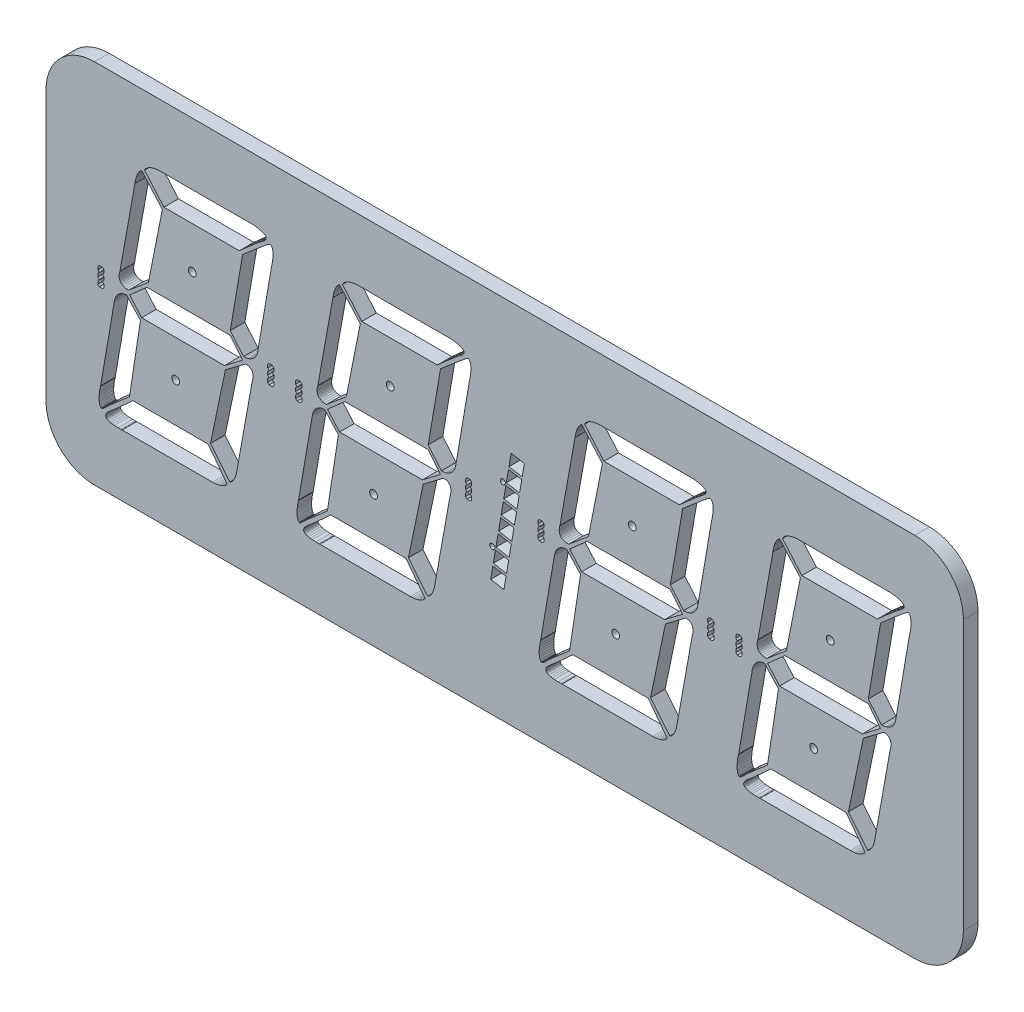
from build123d import *

# Parameters (mm, degrees)
CROQUIS1_R              = 1.6
CROQUIS1_R_2            = 1.054294776
SALIENTE_EXTRUIR1_DEPTH = 6


with BuildPart() as part:
    # Croquis1 → Saliente-Extruir1 (new body)
    with BuildSketch(Plane.XY):
        with BuildLine():
            Line((94.93, 110.871), (94.93, 0))
            ThreePointArc((94.93, 0), (89.072135624, -14.142135624), (74.93, -20))
            Line((74.93, -20), (-262.531032337, -20))
            ThreePointArc((-262.531032337, -20), (-276.673167961, -14.142135624), (-282.531032337, 0))
            Line((-282.531032337, 0), (-282.531032337, 110.871))
            ThreePointArc((-282.531032337, 110.871), (-276.673167961, 125.013135624), (-262.531032337, 130.871))
            Line((-262.531032337, 130.871), (74.93, 130.871))
            ThreePointArc((74.93, 130.871), (89.072135624, 125.013135624), (94.93, 110.871))
        make_face()
        with Locations((-48.1255, 34.1427)):
            Circle(CROQUIS1_R, mode=Mode.SUBTRACT)
        with Locations((33.3045, 34.1427)):
            Circle(CROQUIS1_R, mode=Mode.SUBTRACT)
        with Locations((40.1269, 76.0705)):
            Circle(CROQUIS1_R, mode=Mode.SUBTRACT)
        with Locations((-41.3031, 76.0705)):
            Circle(CROQUIS1_R, mode=Mode.SUBTRACT)
        with Locations((-98.91149665, 39.952671307)):
            Circle(CROQUIS1_R_2, mode=Mode.SUBTRACT)
        with Locations((-94.590589685, 65.177763821)):
            Circle(CROQUIS1_R_2, mode=Mode.SUBTRACT)
        with Locations((-140.933851545, 76.0705)):
            Circle(CROQUIS1_R, mode=Mode.SUBTRACT)
        with Locations((-147.756251545, 34.1427)):
            Circle(CROQUIS1_R, mode=Mode.SUBTRACT)
        with Locations((-222.363851545, 76.0705)):
            Circle(CROQUIS1_R, mode=Mode.SUBTRACT)
        with Locations((-229.186251545, 34.1427)):
            Circle(CROQUIS1_R, mode=Mode.SUBTRACT)
        with BuildLine():
            Line((67.9113425, 100.564559567), (69.4411, 101.7626))
            Line((69.4411, 101.7626), (70.0481, 102.301))
            Line((70.0481, 102.301), (70.2539, 102.55))
            Line((70.2539, 102.55), (70.3986, 102.7862))
            Line((70.3986, 102.7862), (70.485, 103.0097))
            Line((70.485, 103.0097), (70.5206, 103.2205))
            Line((70.5206, 103.2205), (70.5053, 103.4212))
            Line((70.5053, 103.4212), (70.4444, 103.6091))
            Line((70.4444, 103.6091), (70.3428, 103.7844))
            Line((70.3428, 103.7844), (70.2031, 103.9495))
            Line((70.2031, 103.9495), (69.8246, 104.2492))
            Line((69.8246, 104.2492), (69.3395, 104.5083))
            Line((69.3395, 104.5083), (68.7781, 104.7293))
            Line((68.7781, 104.7293), (68.1685, 104.9147))
            Line((68.1685, 104.9147), (67.5437, 105.0671))
            Line((67.5437, 105.0671), (66.3626, 105.2855))
            Line((66.3626, 105.2855), (65.1307, 105.4329))
            Line((65.1307, 105.4329), (49.15669989, 105.387245475))
            ThreePointArc((49.15669989, 105.387245475), (49.105988252, 105.336299978), (49.055099911, 105.387068971))
            Line((49.055099911, 105.387068971), (36.738750212, 105.379531182))
            ThreePointArc((36.738750212, 105.379531182), (36.68781574, 105.328699956), (36.637150663, 105.3797997))
            Line((36.637150663, 105.3797997), (28.152949348, 105.430002075))
            ThreePointArc((28.152949348, 105.430002075), (28.102277149, 105.379499938), (28.05135278, 105.429747786))
            Line((28.05135278, 105.429747786), (26.924, 105.4176))
            Line((26.924, 105.4176), (25.8724, 105.3389))
            Line((25.8724, 105.3389), (24.9403, 105.2068))
            Line((24.9403, 105.2068), (24.1173, 105.0265))
            Line((24.1173, 105.0265), (23.401, 104.808))
            Line((23.401, 104.808), (22.7838, 104.5616))
            Line((22.7838, 104.5616), (22.258, 104.2949))
            Line((22.258, 104.2949), (21.8161, 104.0181))
            Line((21.8161, 104.0181), (21.4528, 103.7412))
            Line((21.4528, 103.7412), (21.1607, 103.472))
            Line((21.1607, 103.472), (20.7594, 102.9894))
            Line((20.7594, 102.9894), (20.5588, 102.649))
            Line((20.5588, 102.649), (20.5054, 102.5195))
            Line((20.5054, 102.5195), (28.4658, 93.2942))
            Line((28.4658, 93.2942), (59.502, 93.2942))
            Line((59.502, 93.2942), (62.941023468, 96.363933685))
            ThreePointArc((62.941023468, 96.363933685), (62.945494124, 96.43599486), (63.017509764, 96.430842441))
            Line((63.017509764, 96.430842441), (66.171178839, 99.133262262))
            ThreePointArc((66.171178839, 99.133262262), (66.177093675, 99.205294689), (66.24906445, 99.198671749))
            Line((66.24906445, 99.198671749), (67.832082216, 100.500937582))
            ThreePointArc((67.832082216, 100.500937582), (67.839536944, 100.572832713), (67.9113425, 100.564559567))
        make_face(mode=Mode.SUBTRACT)
        with BuildLine():
            Line((72.729567136, 94.156365417), (72.8447, 94.6353))
            Line((72.8447, 94.6353), (73.1063, 95.9968))
            Line((73.1063, 95.9968), (73.2307, 96.8883))
            Line((73.2307, 96.8883), (73.3171, 97.8662))
            Line((73.3171, 97.8662), (73.3501, 98.8873))
            Line((73.3501, 98.8873), (73.2993, 99.9109))
            Line((73.2993, 99.9109), (73.2028, 100.5484))
            Line((73.2028, 100.5484), (73.0098, 101.1682))
            Line((73.0098, 101.1682), (72.8701, 101.44))
            Line((72.8701, 101.44), (72.6973, 101.6635))
            Line((72.6973, 101.6635), (72.4916, 101.8311))
            Line((72.4916, 101.8311), (72.2452, 101.9277))
            Line((72.2452, 101.9277), (72.136, 101.915))
            Line((72.136, 101.915), (71.9709, 101.8438))
            Line((71.9709, 101.8438), (71.5137, 101.5644))
            Line((71.5137, 101.5644), (70.3199, 100.678))
            Line((70.3199, 100.678), (68.7172, 99.3623))
            Line((68.7172, 99.3623), (60.8457, 92.6084))
            Line((60.8457, 92.6084), (55.7809, 62.992))
            Line((55.7809, 62.992), (61.2038, 56.449))
            Line((61.2038, 56.449), (61.4223, 56.449))
            Line((61.4223, 56.449), (62.0039, 56.4896))
            Line((62.0039, 56.4896), (62.8421, 56.6395))
            Line((62.8421, 56.6395), (63.3247, 56.7741))
            Line((63.3247, 56.7741), (63.8302, 56.962))
            Line((63.8302, 56.962), (64.3458, 57.2059))
            Line((64.3458, 57.2059), (64.8564, 57.5183))
            Line((64.8564, 57.5183), (65.3491, 57.9069))
            Line((65.3491, 57.9069), (65.8139, 58.3794))
            Line((65.8139, 58.3794), (66.233, 58.9432))
            Line((66.233, 58.9432), (66.5937, 59.6062))
            Line((66.5937, 59.6062), (66.8833, 60.3758))
            Line((66.8833, 60.3758), (67.089, 61.2623))
            Line((67.089, 61.2623), (72.7091207, 94.056937903))
            ThreePointArc((72.7091207, 94.056937903), (72.667907393, 94.117229151), (72.729567136, 94.156365417))
        make_face(mode=Mode.SUBTRACT)
        with BuildLine():
            Line((64.803353247, 49.377682843), (64.8564, 49.5427))
            Line((64.8564, 49.5427), (64.9935, 50.1015))
            Line((64.9935, 50.1015), (65.1104, 50.8914))
            Line((65.1104, 50.8914), (65.1332, 51.3385))
            Line((65.1332, 51.3385), (65.1129, 51.7982))
            Line((65.1129, 51.7982), (65.0418, 52.2605))
            Line((65.0418, 52.2605), (64.9072, 52.705))
            Line((64.9072, 52.705), (64.6989, 53.1241))
            Line((64.6989, 53.1241), (64.4017, 53.4975))
            Line((64.4017, 53.4975), (64.0055, 53.8124))
            Line((64.0055, 53.8124), (63.5, 54.0563))
            Line((63.5, 54.0563), (62.8752, 54.2138))
            Line((62.8752, 54.2138), (62.1132, 54.2696))
            Line((62.1132, 54.2696), (53.7591, 47.9984))
            Line((53.7591, 47.9984), (47.6428, 18.6919))
            Line((47.6428, 18.6919), (55.5422, 8.9256))
            Line((55.5422, 8.9256), (55.6438, 8.9713))
            Line((55.6438, 8.9713), (55.9156, 9.1364))
            Line((55.9156, 9.1364), (56.3169, 9.4615))
            Line((56.3169, 9.4615), (56.7944, 9.9822))
            Line((56.7944, 9.9822), (57.3075, 10.7417))
            Line((57.3075, 10.7417), (57.5615, 11.2243))
            Line((57.5615, 11.2243), (57.8053, 11.778))
            Line((57.8053, 11.778), (58.0339, 12.413))
            Line((58.0339, 12.413), (58.2422, 13.1318))
            Line((58.2422, 13.1318), (58.4251, 13.9395))
            Line((58.4251, 13.9395), (58.566495382, 14.788249847))
            ThreePointArc((58.566495382, 14.788249847), (58.524804044, 14.847023365), (58.583841761, 14.888339731))
            Line((58.583841761, 14.888339731), (64.778803284, 49.279355188))
            ThreePointArc((64.778803284, 49.279355188), (64.738473644, 49.341653077), (64.803353247, 49.377682843))
        make_face(mode=Mode.SUBTRACT)
        with BuildLine():
            Line((6.446034932, 9.682676262), (5.9385, 9.2507))
            Line((5.9385, 9.2507), (5.4864, 8.8189))
            Line((5.4864, 8.8189), (5.1283, 8.4176))
            Line((5.1283, 8.4176), (4.8565, 8.0493))
            Line((4.8565, 8.0493), (4.666, 7.7089))
            Line((4.666, 7.7089), (4.5517, 7.399))
            Line((4.5517, 7.399), (4.511, 7.1145))
            Line((4.511, 7.1145), (4.5339, 6.858))
            Line((4.5339, 6.858), (4.6177, 6.6243))
            Line((4.6177, 6.6243), (4.7549, 6.416))
            Line((4.7549, 6.416), (4.9454, 6.2281))
            Line((4.9454, 6.2281), (5.1791, 6.063))
            Line((5.1791, 6.063), (5.7607, 5.7887))
            Line((5.7607, 5.7887), (6.4592, 5.5855))
            Line((6.4592, 5.5855), (7.2339, 5.4432))
            Line((7.2339, 5.4432), (8.0391, 5.3492))
            Line((8.0391, 5.3492), (9.5834, 5.2781))
            Line((9.5834, 5.2781), (10.7544, 5.2908))
            Line((10.7544, 5.2908), (11.168448381, 5.308883438))
            ThreePointArc((11.168448381, 5.308883438), (11.218091455, 5.361887903), (11.27, 5.3111))
            Line((11.27, 5.3111), (48.4861, 5.3111))
            Line((48.4861, 5.3111), (49.3293, 5.3391))
            Line((49.3293, 5.3391), (50.0964, 5.4102))
            Line((50.0964, 5.4102), (50.7898, 5.5245))
            Line((50.7898, 5.5245), (51.4121, 5.6693))
            Line((51.4121, 5.6693), (51.9684, 5.842))
            Line((51.9684, 5.842), (52.4612, 6.0376))
            Line((52.4612, 6.0376), (53.2638, 6.4567))
            Line((53.2638, 6.4567), (53.848, 6.8758))
            Line((53.848, 6.8758), (54.2341, 7.2441))
            Line((54.2341, 7.2441), (54.516, 7.6022))
            Line((54.516, 7.6022), (46.6166, 17.9756))
            Line((46.6166, 17.9756), (15.6794, 17.9756))
            Line((15.6794, 17.9756), (11.973109053, 14.565899445))
            ThreePointArc((11.973109053, 14.565899445), (11.969875017, 14.493977228), (11.897963922, 14.497449787))
            Line((11.897963922, 14.497449787), (8.920105145, 11.812002677))
            ThreePointArc((8.920105145, 11.812002677), (8.915958328, 11.739898837), (8.843908054, 11.744890634))
            Line((8.843908054, 11.744890634), (6.52320707, 9.748708391))
            ThreePointArc((6.52320707, 9.748708391), (6.517716159, 9.677013821), (6.446034932, 9.682676262))
        make_face(mode=Mode.SUBTRACT)
        Polygon((19.2989, 49.3217), (53.3959, 49.3217), (60.8457, 54.9885), (55.7809, 61.2623), (21.5011, 61.2623), (14.3535, 54.9885), align=None, mode=Mode.SUBTRACT)
        with BuildLine():
            Line((2.429025602, 16.559695023), (2.3139, 16.0807))
            Line((2.3139, 16.0807), (2.0523, 14.7193))
            Line((2.0523, 14.7193), (1.9279, 13.8278))
            Line((1.9279, 13.8278), (1.839, 12.8524))
            Line((1.839, 12.8524), (1.8085, 11.8313))
            Line((1.8085, 11.8313), (1.8567, 10.8052))
            Line((1.8567, 10.8052), (1.9558, 10.1676))
            Line((1.9558, 10.1676), (2.1488, 9.5479))
            Line((2.1488, 9.5479), (2.2885, 9.2786))
            Line((2.2885, 9.2786), (2.4587, 9.0526))
            Line((2.4587, 9.0526), (2.667, 8.8849))
            Line((2.667, 8.8849), (2.9108, 8.7884))
            Line((2.9108, 8.7884), (3.015, 8.8036))
            Line((3.015, 8.8036), (3.1623, 8.8748))
            Line((3.1623, 8.8748), (3.5535, 9.1516))
            Line((3.5535, 9.1516), (4.5491, 10.0381))
            Line((4.5491, 10.0381), (5.826468257, 11.320331828))
            ThreePointArc((5.826468257, 11.320331828), (5.827626913, 11.393484883), (5.900687564, 11.389630887))
            Line((5.900687564, 11.389630887), (14.3078, 18.6893))
            Line((14.3078, 18.6893), (18.8239, 48.1228))
            Line((18.8239, 48.1228), (13.1801, 54.2798))
            Line((13.1801, 54.2798), (12.9972, 54.2798))
            Line((12.9972, 54.2798), (12.5019, 54.2366))
            Line((12.5019, 54.2366), (11.7856, 54.0868))
            Line((11.7856, 54.0868), (11.3741, 53.9496))
            Line((11.3741, 53.9496), (10.9423, 53.7616))
            Line((10.9423, 53.7616), (10.4978, 53.5153))
            Line((10.4978, 53.5153), (10.0559, 53.2003))
            Line((10.0559, 53.2003), (9.6291, 52.8117))
            Line((9.6291, 52.8117), (9.2227, 52.3392))
            Line((9.2227, 52.3392), (8.8544, 51.7754))
            Line((8.8544, 51.7754), (8.5293, 51.1124))
            Line((8.5293, 51.1124), (8.2652, 50.3403))
            Line((8.2652, 50.3403), (8.067, 49.4538))
            Line((8.067, 49.4538), (2.449465702, 16.659105847))
            ThreePointArc((2.449465702, 16.659105847), (2.490684624, 16.598823944), (2.429025602, 16.559695023))
        make_face(mode=Mode.SUBTRACT)
        with BuildLine():
            Line((10.35225, 61.33855), (10.2972, 61.1734))
            Line((10.2972, 61.1734), (10.1575, 60.6146))
            Line((10.1575, 60.6146), (10.0559, 59.8246))
            Line((10.0559, 59.8246), (10.0533, 59.3776))
            Line((10.0533, 59.3776), (10.1016, 58.9178))
            Line((10.1016, 58.9178), (10.2133, 58.4556))
            Line((10.2133, 58.4556), (10.4013, 58.0111))
            Line((10.4013, 58.0111), (10.6807, 57.5945))
            Line((10.6807, 57.5945), (11.0668, 57.2211))
            Line((11.0668, 57.2211), (11.5697, 56.9036))
            Line((11.5697, 56.9036), (12.2047, 56.6598))
            Line((12.2047, 56.6598), (12.9819, 56.5048))
            Line((12.9819, 56.5048), (13.9217, 56.449))
            Line((13.9217, 56.449), (22.0904, 63.2993))
            Line((22.0904, 63.2993), (27.8257, 92.1614))
            Line((27.8257, 92.1614), (19.3167, 101.7626))
            Line((19.3167, 101.7626), (18.9865, 101.5543))
            Line((18.9865, 101.5543), (18.636, 101.2342))
            Line((18.636, 101.2342), (18.2118, 100.7186))
            Line((18.2118, 100.7186), (17.7546, 99.9642))
            Line((17.7546, 99.9642), (17.305, 98.933))
            Line((17.305, 98.933), (17.0942, 98.3005))
            Line((17.0942, 98.3005), (16.9012, 97.5843))
            Line((16.9012, 97.5843), (16.7284, 96.7765))
            Line((16.7284, 96.7765), (16.589384826, 95.927969499))
            ThreePointArc((16.589384826, 95.927969499), (16.63129794, 95.869188009), (16.572161469, 95.827777256))
            Line((16.572161469, 95.827777256), (10.377314731, 61.436745771))
            ThreePointArc((10.377314731, 61.436745771), (10.417523735, 61.374185511), (10.35225, 61.33855))
        make_face(mode=Mode.SUBTRACT)
        with BuildLine():
            Line((1.8616, 56.6746), (1.2625, 56.0755))
            Line((1.2625, 56.0755), (1.2625, 54.8055))
            Line((1.2625, 54.8055), (1.8616, 54.2064))
            ThreePointArc((1.8616, 54.2064), (1.948355635, 54.1705), (1.8616, 54.1346))
            Line((1.8616, 54.1346), (1.2625, 53.5355))
            Line((1.2625, 53.5355), (1.2625, 52.2655))
            Line((1.2625, 52.2655), (1.8975, 51.6305))
            Line((1.8975, 51.6305), (3.1675, 51.6305))
            Line((3.1675, 51.6305), (3.8025, 52.2655))
            Line((3.8025, 52.2655), (3.8025, 53.5355))
            Line((3.8025, 53.5355), (3.20345, 54.13455))
            ThreePointArc((3.20345, 54.13455), (3.116744365, 54.1705), (3.20345, 54.20645))
            Line((3.20345, 54.20645), (3.8025, 54.8055))
            Line((3.8025, 54.8055), (3.8025, 56.0755))
            Line((3.8025, 56.0755), (3.20345, 56.67455))
            ThreePointArc((3.20345, 56.67455), (3.116744365, 56.7105), (3.20345, 56.74645))
            Line((3.20345, 56.74645), (3.8025, 57.3455))
            Line((3.8025, 57.3455), (3.8025, 58.6155))
            Line((3.8025, 58.6155), (3.1675, 59.2505))
            Line((3.1675, 59.2505), (1.8975, 59.2505))
            Line((1.8975, 59.2505), (1.2625, 58.6155))
            Line((1.2625, 58.6155), (1.2625, 57.3455))
            Line((1.2625, 57.3455), (1.8616, 56.7464))
            ThreePointArc((1.8616, 56.7464), (1.948355635, 56.7105), (1.8616, 56.6746))
        make_face(mode=Mode.SUBTRACT)
        Polygon((-9.6486, 54.1781), (-10.2836, 53.5431), (-10.2836, 52.2731), (-9.6486, 51.6381), (-8.3786, 51.6381), (-7.7436, 52.2731), (-7.7436, 53.5431), (-8.3786, 54.1781), (-7.7436, 54.8131), (-7.7436, 56.0831), (-8.3786, 56.7181), (-7.7436, 57.3531), (-7.7436, 58.6231), (-8.3786, 59.2581), (-9.6486, 59.2581), (-10.2836, 58.6231), (-10.2836, 57.3531), (-9.6486, 56.7181), (-10.2836, 56.0831), (-10.2836, 54.8131), align=None, mode=Mode.SUBTRACT)
        with BuildLine():
            Line((-74.983965068, 9.682676262), (-75.4915, 9.2507))
            Line((-75.4915, 9.2507), (-75.9436, 8.8189))
            Line((-75.9436, 8.8189), (-76.3017, 8.4176))
            Line((-76.3017, 8.4176), (-76.5735, 8.0493))
            Line((-76.5735, 8.0493), (-76.764, 7.7089))
            Line((-76.764, 7.7089), (-76.8783, 7.399))
            Line((-76.8783, 7.399), (-76.919, 7.1145))
            Line((-76.919, 7.1145), (-76.8961, 6.858))
            Line((-76.8961, 6.858), (-76.8123, 6.6243))
            Line((-76.8123, 6.6243), (-76.6751, 6.416))
            Line((-76.6751, 6.416), (-76.4846, 6.2281))
            Line((-76.4846, 6.2281), (-76.2509, 6.063))
            Line((-76.2509, 6.063), (-75.6693, 5.7887))
            Line((-75.6693, 5.7887), (-74.9708, 5.5855))
            Line((-74.9708, 5.5855), (-74.1961, 5.4432))
            Line((-74.1961, 5.4432), (-73.3909, 5.3492))
            Line((-73.3909, 5.3492), (-71.8466, 5.2781))
            Line((-71.8466, 5.2781), (-70.6756, 5.2908))
            Line((-70.6756, 5.2908), (-70.261551619, 5.308883438))
            ThreePointArc((-70.261551619, 5.308883438), (-70.211908545, 5.361887903), (-70.16, 5.3111))
            Line((-70.16, 5.3111), (-32.9439, 5.3111))
            Line((-32.9439, 5.3111), (-32.1007, 5.3391))
            Line((-32.1007, 5.3391), (-31.3336, 5.4102))
            Line((-31.3336, 5.4102), (-30.6402, 5.5245))
            Line((-30.6402, 5.5245), (-30.0179, 5.6693))
            Line((-30.0179, 5.6693), (-29.4616, 5.842))
            Line((-29.4616, 5.842), (-28.9688, 6.0376))
            Line((-28.9688, 6.0376), (-28.1662, 6.4567))
            Line((-28.1662, 6.4567), (-27.582, 6.8758))
            Line((-27.582, 6.8758), (-27.1959, 7.2441))
            Line((-27.1959, 7.2441), (-26.914, 7.6022))
            Line((-26.914, 7.6022), (-34.8134, 17.9756))
            Line((-34.8134, 17.9756), (-65.7506, 17.9756))
            Line((-65.7506, 17.9756), (-69.456890947, 14.565899445))
            ThreePointArc((-69.456890947, 14.565899445), (-69.460124983, 14.493977228), (-69.532036078, 14.497449787))
            Line((-69.532036078, 14.497449787), (-72.509894855, 11.812002677))
            ThreePointArc((-72.509894855, 11.812002677), (-72.514041672, 11.739898837), (-72.586091946, 11.744890634))
            Line((-72.586091946, 11.744890634), (-74.90679293, 9.748708391))
            ThreePointArc((-74.90679293, 9.748708391), (-74.912283841, 9.677013821), (-74.983965068, 9.682676262))
        make_face(mode=Mode.SUBTRACT)
        with BuildLine():
            Line((-16.626646753, 49.377682843), (-16.5736, 49.5427))
            Line((-16.5736, 49.5427), (-16.4365, 50.1015))
            Line((-16.4365, 50.1015), (-16.3196, 50.8914))
            Line((-16.3196, 50.8914), (-16.2968, 51.3385))
            Line((-16.2968, 51.3385), (-16.3171, 51.7982))
            Line((-16.3171, 51.7982), (-16.3882, 52.2605))
            Line((-16.3882, 52.2605), (-16.5228, 52.705))
            Line((-16.5228, 52.705), (-16.7311, 53.1241))
            Line((-16.7311, 53.1241), (-17.0283, 53.4975))
            Line((-17.0283, 53.4975), (-17.4245, 53.8124))
            Line((-17.4245, 53.8124), (-17.93, 54.0563))
            Line((-17.93, 54.0563), (-18.5548, 54.2138))
            Line((-18.5548, 54.2138), (-19.3168, 54.2696))
            Line((-19.3168, 54.2696), (-27.6709, 47.9984))
            Line((-27.6709, 47.9984), (-33.7872, 18.6919))
            Line((-33.7872, 18.6919), (-25.8878, 8.9256))
            Line((-25.8878, 8.9256), (-25.7862, 8.9713))
            Line((-25.7862, 8.9713), (-25.5144, 9.1364))
            Line((-25.5144, 9.1364), (-25.1131, 9.4615))
            Line((-25.1131, 9.4615), (-24.6356, 9.9822))
            Line((-24.6356, 9.9822), (-24.1225, 10.7417))
            Line((-24.1225, 10.7417), (-23.8685, 11.2243))
            Line((-23.8685, 11.2243), (-23.6247, 11.778))
            Line((-23.6247, 11.778), (-23.3961, 12.413))
            Line((-23.3961, 12.413), (-23.1878, 13.1318))
            Line((-23.1878, 13.1318), (-23.0049, 13.9395))
            Line((-23.0049, 13.9395), (-22.863504618, 14.788249847))
            ThreePointArc((-22.863504618, 14.788249847), (-22.905195956, 14.847023365), (-22.846158239, 14.888339731))
            Line((-22.846158239, 14.888339731), (-16.651196716, 49.279355188))
            ThreePointArc((-16.651196716, 49.279355188), (-16.691526356, 49.341653077), (-16.626646753, 49.377682843))
        make_face(mode=Mode.SUBTRACT)
        with BuildLine():
            Line((-8.700432864, 94.156365417), (-8.5853, 94.6353))
            Line((-8.5853, 94.6353), (-8.3237, 95.9968))
            Line((-8.3237, 95.9968), (-8.1993, 96.8883))
            Line((-8.1993, 96.8883), (-8.1129, 97.8662))
            Line((-8.1129, 97.8662), (-8.0799, 98.8873))
            Line((-8.0799, 98.8873), (-8.1307, 99.9109))
            Line((-8.1307, 99.9109), (-8.2272, 100.5484))
            Line((-8.2272, 100.5484), (-8.4202, 101.1682))
            Line((-8.4202, 101.1682), (-8.5599, 101.44))
            Line((-8.5599, 101.44), (-8.7327, 101.6635))
            Line((-8.7327, 101.6635), (-8.9384, 101.8311))
            Line((-8.9384, 101.8311), (-9.1848, 101.9277))
            Line((-9.1848, 101.9277), (-9.294, 101.915))
            Line((-9.294, 101.915), (-9.4591, 101.8438))
            Line((-9.4591, 101.8438), (-9.9163, 101.5644))
            Line((-9.9163, 101.5644), (-11.1101, 100.678))
            Line((-11.1101, 100.678), (-12.7128, 99.3623))
            Line((-12.7128, 99.3623), (-20.5843, 92.6084))
            Line((-20.5843, 92.6084), (-25.6491, 62.992))
            Line((-25.6491, 62.992), (-20.2262, 56.449))
            Line((-20.2262, 56.449), (-20.0077, 56.449))
            Line((-20.0077, 56.449), (-19.4261, 56.4896))
            Line((-19.4261, 56.4896), (-18.5879, 56.6395))
            Line((-18.5879, 56.6395), (-18.1053, 56.7741))
            Line((-18.1053, 56.7741), (-17.5998, 56.962))
            Line((-17.5998, 56.962), (-17.0842, 57.2059))
            Line((-17.0842, 57.2059), (-16.5736, 57.5183))
            Line((-16.5736, 57.5183), (-16.0809, 57.9069))
            Line((-16.0809, 57.9069), (-15.6161, 58.3794))
            Line((-15.6161, 58.3794), (-15.197, 58.9432))
            Line((-15.197, 58.9432), (-14.8363, 59.6062))
            Line((-14.8363, 59.6062), (-14.5467, 60.3758))
            Line((-14.5467, 60.3758), (-14.341, 61.2623))
            Line((-14.341, 61.2623), (-8.7208793, 94.056937903))
            ThreePointArc((-8.7208793, 94.056937903), (-8.762092607, 94.117229151), (-8.700432864, 94.156365417))
        make_face(mode=Mode.SUBTRACT)
        with BuildLine():
            Line((-13.5186575, 100.564559567), (-11.9889, 101.7626))
            Line((-11.9889, 101.7626), (-11.3819, 102.301))
            Line((-11.3819, 102.301), (-11.1761, 102.55))
            Line((-11.1761, 102.55), (-11.0314, 102.7862))
            Line((-11.0314, 102.7862), (-10.945, 103.0097))
            Line((-10.945, 103.0097), (-10.9094, 103.2205))
            Line((-10.9094, 103.2205), (-10.9247, 103.4212))
            Line((-10.9247, 103.4212), (-10.9856, 103.6091))
            Line((-10.9856, 103.6091), (-11.0872, 103.7844))
            Line((-11.0872, 103.7844), (-11.2269, 103.9495))
            Line((-11.2269, 103.9495), (-11.6054, 104.2492))
            Line((-11.6054, 104.2492), (-12.0905, 104.5083))
            Line((-12.0905, 104.5083), (-12.6519, 104.7293))
            Line((-12.6519, 104.7293), (-13.2615, 104.9147))
            Line((-13.2615, 104.9147), (-13.8863, 105.0671))
            Line((-13.8863, 105.0671), (-15.0674, 105.2855))
            Line((-15.0674, 105.2855), (-16.2993, 105.4329))
            Line((-16.2993, 105.4329), (-32.27330011, 105.387245475))
            ThreePointArc((-32.27330011, 105.387245475), (-32.324011748, 105.336299978), (-32.374900089, 105.387068971))
            Line((-32.374900089, 105.387068971), (-44.691249788, 105.379531182))
            ThreePointArc((-44.691249788, 105.379531182), (-44.74218426, 105.328699956), (-44.792849337, 105.3797997))
            Line((-44.792849337, 105.3797997), (-53.277050652, 105.430002075))
            ThreePointArc((-53.277050652, 105.430002075), (-53.327722851, 105.379499938), (-53.37864722, 105.429747786))
            Line((-53.37864722, 105.429747786), (-54.506, 105.4176))
            Line((-54.506, 105.4176), (-55.5576, 105.3389))
            Line((-55.5576, 105.3389), (-56.4897, 105.2068))
            Line((-56.4897, 105.2068), (-57.3127, 105.0265))
            Line((-57.3127, 105.0265), (-58.029, 104.808))
            Line((-58.029, 104.808), (-58.6462, 104.5616))
            Line((-58.6462, 104.5616), (-59.172, 104.2949))
            Line((-59.172, 104.2949), (-59.6139, 104.0181))
            Line((-59.6139, 104.0181), (-59.9772, 103.7412))
            Line((-59.9772, 103.7412), (-60.2693, 103.472))
            Line((-60.2693, 103.472), (-60.6706, 102.9894))
            Line((-60.6706, 102.9894), (-60.8712, 102.649))
            Line((-60.8712, 102.649), (-60.9246, 102.5195))
            Line((-60.9246, 102.5195), (-52.9642, 93.2942))
            Line((-52.9642, 93.2942), (-21.928, 93.2942))
            Line((-21.928, 93.2942), (-18.488976532, 96.363933685))
            ThreePointArc((-18.488976532, 96.363933685), (-18.484505876, 96.43599486), (-18.412490236, 96.430842441))
            Line((-18.412490236, 96.430842441), (-15.258821161, 99.133262262))
            ThreePointArc((-15.258821161, 99.133262262), (-15.252906325, 99.205294689), (-15.18093555, 99.198671749))
            Line((-15.18093555, 99.198671749), (-13.597917784, 100.500937582))
            ThreePointArc((-13.597917784, 100.500937582), (-13.590463056, 100.572832713), (-13.5186575, 100.564559567))
        make_face(mode=Mode.SUBTRACT)
        Polygon((-62.1311, 49.3217), (-28.0341, 49.3217), (-20.5843, 54.9885), (-25.6491, 61.2623), (-59.9289, 61.2623), (-67.0765, 54.9885), align=None, mode=Mode.SUBTRACT)
        with BuildLine():
            Line((-79.000974398, 16.559695023), (-79.1161, 16.0807))
            Line((-79.1161, 16.0807), (-79.3777, 14.7193))
            Line((-79.3777, 14.7193), (-79.5021, 13.8278))
            Line((-79.5021, 13.8278), (-79.591, 12.8524))
            Line((-79.591, 12.8524), (-79.6215, 11.8313))
            Line((-79.6215, 11.8313), (-79.5733, 10.8052))
            Line((-79.5733, 10.8052), (-79.4742, 10.1676))
            Line((-79.4742, 10.1676), (-79.2812, 9.5479))
            Line((-79.2812, 9.5479), (-79.1415, 9.2786))
            Line((-79.1415, 9.2786), (-78.9713, 9.0526))
            Line((-78.9713, 9.0526), (-78.763, 8.8849))
            Line((-78.763, 8.8849), (-78.5192, 8.7884))
            Line((-78.5192, 8.7884), (-78.415, 8.8036))
            Line((-78.415, 8.8036), (-78.2677, 8.8748))
            Line((-78.2677, 8.8748), (-77.8765, 9.1516))
            Line((-77.8765, 9.1516), (-76.8809, 10.0381))
            Line((-76.8809, 10.0381), (-75.603531743, 11.320331828))
            ThreePointArc((-75.603531743, 11.320331828), (-75.602373087, 11.393484883), (-75.529312436, 11.389630887))
            Line((-75.529312436, 11.389630887), (-67.1222, 18.6893))
            Line((-67.1222, 18.6893), (-62.6061, 48.1228))
            Line((-62.6061, 48.1228), (-68.2499, 54.2798))
            Line((-68.2499, 54.2798), (-68.4328, 54.2798))
            Line((-68.4328, 54.2798), (-68.9281, 54.2366))
            Line((-68.9281, 54.2366), (-69.6444, 54.0868))
            Line((-69.6444, 54.0868), (-70.0559, 53.9496))
            Line((-70.0559, 53.9496), (-70.4877, 53.7616))
            Line((-70.4877, 53.7616), (-70.9322, 53.5153))
            Line((-70.9322, 53.5153), (-71.3741, 53.2003))
            Line((-71.3741, 53.2003), (-71.8009, 52.8117))
            Line((-71.8009, 52.8117), (-72.2073, 52.3392))
            Line((-72.2073, 52.3392), (-72.5756, 51.7754))
            Line((-72.5756, 51.7754), (-72.9007, 51.1124))
            Line((-72.9007, 51.1124), (-73.1648, 50.3403))
            Line((-73.1648, 50.3403), (-73.363, 49.4538))
            Line((-73.363, 49.4538), (-78.980534298, 16.659105847))
            ThreePointArc((-78.980534298, 16.659105847), (-78.939315376, 16.598823944), (-79.000974398, 16.559695023))
        make_face(mode=Mode.SUBTRACT)
        with BuildLine():
            Line((-71.07775, 61.33855), (-71.1328, 61.1734))
            Line((-71.1328, 61.1734), (-71.2725, 60.6146))
            Line((-71.2725, 60.6146), (-71.3741, 59.8246))
            Line((-71.3741, 59.8246), (-71.3767, 59.3776))
            Line((-71.3767, 59.3776), (-71.3284, 58.9178))
            Line((-71.3284, 58.9178), (-71.2167, 58.4556))
            Line((-71.2167, 58.4556), (-71.0287, 58.0111))
            Line((-71.0287, 58.0111), (-70.7493, 57.5945))
            Line((-70.7493, 57.5945), (-70.3632, 57.2211))
            Line((-70.3632, 57.2211), (-69.8603, 56.9036))
            Line((-69.8603, 56.9036), (-69.2253, 56.6598))
            Line((-69.2253, 56.6598), (-68.4481, 56.5048))
            Line((-68.4481, 56.5048), (-67.5083, 56.449))
            Line((-67.5083, 56.449), (-59.3396, 63.2993))
            Line((-59.3396, 63.2993), (-53.6043, 92.1614))
            Line((-53.6043, 92.1614), (-62.1133, 101.7626))
            Line((-62.1133, 101.7626), (-62.4435, 101.5543))
            Line((-62.4435, 101.5543), (-62.794, 101.2342))
            Line((-62.794, 101.2342), (-63.2182, 100.7186))
            Line((-63.2182, 100.7186), (-63.6754, 99.9642))
            Line((-63.6754, 99.9642), (-64.125, 98.933))
            Line((-64.125, 98.933), (-64.3358, 98.3005))
            Line((-64.3358, 98.3005), (-64.5288, 97.5843))
            Line((-64.5288, 97.5843), (-64.7016, 96.7765))
            Line((-64.7016, 96.7765), (-64.840615174, 95.927969499))
            ThreePointArc((-64.840615174, 95.927969499), (-64.79870206, 95.869188009), (-64.857838531, 95.827777256))
            Line((-64.857838531, 95.827777256), (-71.052685269, 61.436745771))
            ThreePointArc((-71.052685269, 61.436745771), (-71.012476265, 61.374185511), (-71.07775, 61.33855))
        make_face(mode=Mode.SUBTRACT)
        with BuildLine():
            Line((-79.5684, 56.6746), (-80.1675, 56.0755))
            Line((-80.1675, 56.0755), (-80.1675, 54.8055))
            Line((-80.1675, 54.8055), (-79.5684, 54.2064))
            ThreePointArc((-79.5684, 54.2064), (-79.481644365, 54.1705), (-79.5684, 54.1346))
            Line((-79.5684, 54.1346), (-80.1675, 53.5355))
            Line((-80.1675, 53.5355), (-80.1675, 52.2655))
            Line((-80.1675, 52.2655), (-79.5325, 51.6305))
            Line((-79.5325, 51.6305), (-78.2625, 51.6305))
            Line((-78.2625, 51.6305), (-77.6275, 52.2655))
            Line((-77.6275, 52.2655), (-77.6275, 53.5355))
            Line((-77.6275, 53.5355), (-78.22655, 54.13455))
            ThreePointArc((-78.22655, 54.13455), (-78.313255635, 54.1705), (-78.22655, 54.20645))
            Line((-78.22655, 54.20645), (-77.6275, 54.8055))
            Line((-77.6275, 54.8055), (-77.6275, 56.0755))
            Line((-77.6275, 56.0755), (-78.22655, 56.67455))
            ThreePointArc((-78.22655, 56.67455), (-78.313255635, 56.7105), (-78.22655, 56.74645))
            Line((-78.22655, 56.74645), (-77.6275, 57.3455))
            Line((-77.6275, 57.3455), (-77.6275, 58.6155))
            Line((-77.6275, 58.6155), (-78.2625, 59.2505))
            Line((-78.2625, 59.2505), (-79.5325, 59.2505))
            Line((-79.5325, 59.2505), (-80.1675, 58.6155))
            Line((-80.1675, 58.6155), (-80.1675, 57.3455))
            Line((-80.1675, 57.3455), (-79.5684, 56.7464))
            ThreePointArc((-79.5684, 56.7464), (-79.481644365, 56.7105), (-79.5684, 56.6746))
        make_face(mode=Mode.SUBTRACT)
        Polygon((-109.279351545, 54.1781), (-109.914351545, 53.5431), (-109.914351545, 52.2731), (-109.279351545, 51.6381), (-108.009351545, 51.6381), (-107.374351545, 52.2731), (-107.374351545, 53.5431), (-108.009351545, 54.1781), (-107.374351545, 54.8131), (-107.374351545, 56.0831), (-108.009351545, 56.7181), (-107.374351545, 57.3531), (-107.374351545, 58.6231), (-108.009351545, 59.2581), (-109.279351545, 59.2581), (-109.914351545, 58.6231), (-109.914351545, 57.3531), (-109.279351545, 56.7181), (-109.914351545, 56.0831), (-109.914351545, 54.8131), align=None, mode=Mode.SUBTRACT)
        with BuildLine():
            Line((-108.331184409, 94.156365417), (-108.216051545, 94.6353))
            Line((-108.216051545, 94.6353), (-107.954451545, 95.9968))
            Line((-107.954451545, 95.9968), (-107.830051545, 96.8883))
            Line((-107.830051545, 96.8883), (-107.743651545, 97.8662))
            Line((-107.743651545, 97.8662), (-107.710651545, 98.8873))
            Line((-107.710651545, 98.8873), (-107.761451545, 99.9109))
            Line((-107.761451545, 99.9109), (-107.857951545, 100.5484))
            Line((-107.857951545, 100.5484), (-108.050951545, 101.1682))
            Line((-108.050951545, 101.1682), (-108.190651545, 101.44))
            Line((-108.190651545, 101.44), (-108.363451545, 101.6635))
            Line((-108.363451545, 101.6635), (-108.569151545, 101.8311))
            Line((-108.569151545, 101.8311), (-108.815551545, 101.9277))
            Line((-108.815551545, 101.9277), (-108.924751545, 101.915))
            Line((-108.924751545, 101.915), (-109.089851545, 101.8438))
            Line((-109.089851545, 101.8438), (-109.547051545, 101.5644))
            Line((-109.547051545, 101.5644), (-110.740851545, 100.678))
            Line((-110.740851545, 100.678), (-112.343551545, 99.3623))
            Line((-112.343551545, 99.3623), (-120.215051545, 92.6084))
            Line((-120.215051545, 92.6084), (-125.279851545, 62.992))
            Line((-125.279851545, 62.992), (-119.856951545, 56.449))
            Line((-119.856951545, 56.449), (-119.638451545, 56.449))
            Line((-119.638451545, 56.449), (-119.056851545, 56.4896))
            Line((-119.056851545, 56.4896), (-118.218651545, 56.6395))
            Line((-118.218651545, 56.6395), (-117.736051545, 56.7741))
            Line((-117.736051545, 56.7741), (-117.230551545, 56.962))
            Line((-117.230551545, 56.962), (-116.714951545, 57.2059))
            Line((-116.714951545, 57.2059), (-116.204351545, 57.5183))
            Line((-116.204351545, 57.5183), (-115.711651545, 57.9069))
            Line((-115.711651545, 57.9069), (-115.246851545, 58.3794))
            Line((-115.246851545, 58.3794), (-114.827751545, 58.9432))
            Line((-114.827751545, 58.9432), (-114.467051545, 59.6062))
            Line((-114.467051545, 59.6062), (-114.177451545, 60.3758))
            Line((-114.177451545, 60.3758), (-113.971751545, 61.2623))
            Line((-113.971751545, 61.2623), (-108.351630845, 94.056937903))
            ThreePointArc((-108.351630845, 94.056937903), (-108.392844152, 94.117229151), (-108.331184409, 94.156365417))
        make_face(mode=Mode.SUBTRACT)
        with BuildLine():
            Line((-113.149409045, 100.564559567), (-111.619651545, 101.7626))
            Line((-111.619651545, 101.7626), (-111.012651545, 102.301))
            Line((-111.012651545, 102.301), (-110.806851545, 102.55))
            Line((-110.806851545, 102.55), (-110.662151545, 102.7862))
            Line((-110.662151545, 102.7862), (-110.575751545, 103.0097))
            Line((-110.575751545, 103.0097), (-110.540151545, 103.2205))
            Line((-110.540151545, 103.2205), (-110.555451545, 103.4212))
            Line((-110.555451545, 103.4212), (-110.616351545, 103.6091))
            Line((-110.616351545, 103.6091), (-110.717951545, 103.7844))
            Line((-110.717951545, 103.7844), (-110.857651545, 103.9495))
            Line((-110.857651545, 103.9495), (-111.236151545, 104.2492))
            Line((-111.236151545, 104.2492), (-111.721251545, 104.5083))
            Line((-111.721251545, 104.5083), (-112.282651545, 104.7293))
            Line((-112.282651545, 104.7293), (-112.892251545, 104.9147))
            Line((-112.892251545, 104.9147), (-113.517051545, 105.0671))
            Line((-113.517051545, 105.0671), (-114.698151545, 105.2855))
            Line((-114.698151545, 105.2855), (-115.930051545, 105.4329))
            Line((-115.930051545, 105.4329), (-131.904051655, 105.387245475))
            ThreePointArc((-131.904051655, 105.387245475), (-131.954763293, 105.336299978), (-132.005651634, 105.387068971))
            Line((-132.005651634, 105.387068971), (-144.322001333, 105.379531182))
            ThreePointArc((-144.322001333, 105.379531182), (-144.372935805, 105.328699956), (-144.423600882, 105.3797997))
            Line((-144.423600882, 105.3797997), (-152.907802197, 105.430002075))
            ThreePointArc((-152.907802197, 105.430002075), (-152.958474396, 105.379499938), (-153.009398765, 105.429747786))
            Line((-153.009398765, 105.429747786), (-154.136751545, 105.4176))
            Line((-154.136751545, 105.4176), (-155.188351545, 105.3389))
            Line((-155.188351545, 105.3389), (-156.120451545, 105.2068))
            Line((-156.120451545, 105.2068), (-156.943451545, 105.0265))
            Line((-156.943451545, 105.0265), (-157.659751545, 104.808))
            Line((-157.659751545, 104.808), (-158.276951545, 104.5616))
            Line((-158.276951545, 104.5616), (-158.802751545, 104.2949))
            Line((-158.802751545, 104.2949), (-159.244651545, 104.0181))
            Line((-159.244651545, 104.0181), (-159.607951545, 103.7412))
            Line((-159.607951545, 103.7412), (-159.900051545, 103.472))
            Line((-159.900051545, 103.472), (-160.301351545, 102.9894))
            Line((-160.301351545, 102.9894), (-160.501951545, 102.649))
            Line((-160.501951545, 102.649), (-160.555351545, 102.5195))
            Line((-160.555351545, 102.5195), (-152.594951545, 93.2942))
            Line((-152.594951545, 93.2942), (-121.558751545, 93.2942))
            Line((-121.558751545, 93.2942), (-118.119728077, 96.363933685))
            ThreePointArc((-118.119728077, 96.363933685), (-118.115257421, 96.43599486), (-118.043241781, 96.430842441))
            Line((-118.043241781, 96.430842441), (-114.889572706, 99.133262262))
            ThreePointArc((-114.889572706, 99.133262262), (-114.88365787, 99.205294689), (-114.811687094, 99.198671749))
            Line((-114.811687094, 99.198671749), (-113.228669329, 100.500937582))
            ThreePointArc((-113.228669329, 100.500937582), (-113.221214601, 100.572832713), (-113.149409045, 100.564559567))
        make_face(mode=Mode.SUBTRACT)
        with BuildLine():
            Line((-116.257398298, 49.377682843), (-116.204351545, 49.5427))
            Line((-116.204351545, 49.5427), (-116.067251545, 50.1015))
            Line((-116.067251545, 50.1015), (-115.950351545, 50.8914))
            Line((-115.950351545, 50.8914), (-115.927551545, 51.3385))
            Line((-115.927551545, 51.3385), (-115.947851545, 51.7982))
            Line((-115.947851545, 51.7982), (-116.018951545, 52.2605))
            Line((-116.018951545, 52.2605), (-116.153551545, 52.705))
            Line((-116.153551545, 52.705), (-116.361851545, 53.1241))
            Line((-116.361851545, 53.1241), (-116.659051545, 53.4975))
            Line((-116.659051545, 53.4975), (-117.055251545, 53.8124))
            Line((-117.055251545, 53.8124), (-117.560751545, 54.0563))
            Line((-117.560751545, 54.0563), (-118.185551545, 54.2138))
            Line((-118.185551545, 54.2138), (-118.947551545, 54.2696))
            Line((-118.947551545, 54.2696), (-127.301651545, 47.9984))
            Line((-127.301651545, 47.9984), (-133.417951545, 18.6919))
            Line((-133.417951545, 18.6919), (-125.518551545, 8.9256))
            Line((-125.518551545, 8.9256), (-125.416951545, 8.9713))
            Line((-125.416951545, 8.9713), (-125.145151545, 9.1364))
            Line((-125.145151545, 9.1364), (-124.743851545, 9.4615))
            Line((-124.743851545, 9.4615), (-124.266351545, 9.9822))
            Line((-124.266351545, 9.9822), (-123.753251545, 10.7417))
            Line((-123.753251545, 10.7417), (-123.499251545, 11.2243))
            Line((-123.499251545, 11.2243), (-123.255451545, 11.778))
            Line((-123.255451545, 11.778), (-123.026851545, 12.413))
            Line((-123.026851545, 12.413), (-122.818551545, 13.1318))
            Line((-122.818551545, 13.1318), (-122.635651545, 13.9395))
            Line((-122.635651545, 13.9395), (-122.494256163, 14.788249847))
            ThreePointArc((-122.494256163, 14.788249847), (-122.535947501, 14.847023365), (-122.476909784, 14.888339731))
            Line((-122.476909784, 14.888339731), (-116.281948261, 49.279355188))
            ThreePointArc((-116.281948261, 49.279355188), (-116.322277901, 49.341653077), (-116.257398298, 49.377682843))
        make_face(mode=Mode.SUBTRACT)
        with BuildLine():
            Line((-174.614716613, 9.682676262), (-175.122251545, 9.2507))
            Line((-175.122251545, 9.2507), (-175.574351545, 8.8189))
            Line((-175.574351545, 8.8189), (-175.932451545, 8.4176))
            Line((-175.932451545, 8.4176), (-176.204251545, 8.0493))
            Line((-176.204251545, 8.0493), (-176.394751545, 7.7089))
            Line((-176.394751545, 7.7089), (-176.509051545, 7.399))
            Line((-176.509051545, 7.399), (-176.549751545, 7.1145))
            Line((-176.549751545, 7.1145), (-176.526851545, 6.858))
            Line((-176.526851545, 6.858), (-176.443051545, 6.6243))
            Line((-176.443051545, 6.6243), (-176.305851545, 6.416))
            Line((-176.305851545, 6.416), (-176.115351545, 6.2281))
            Line((-176.115351545, 6.2281), (-175.881651545, 6.063))
            Line((-175.881651545, 6.063), (-175.300051545, 5.7887))
            Line((-175.300051545, 5.7887), (-174.601551545, 5.5855))
            Line((-174.601551545, 5.5855), (-173.826851545, 5.4432))
            Line((-173.826851545, 5.4432), (-173.021651545, 5.3492))
            Line((-173.021651545, 5.3492), (-171.477351545, 5.2781))
            Line((-171.477351545, 5.2781), (-170.306351545, 5.2908))
            Line((-170.306351545, 5.2908), (-169.892303164, 5.308883438))
            ThreePointArc((-169.892303164, 5.308883438), (-169.84266009, 5.361887903), (-169.790751545, 5.3111))
            Line((-169.790751545, 5.3111), (-132.574651545, 5.3111))
            Line((-132.574651545, 5.3111), (-131.731451545, 5.3391))
            Line((-131.731451545, 5.3391), (-130.964351545, 5.4102))
            Line((-130.964351545, 5.4102), (-130.270951545, 5.5245))
            Line((-130.270951545, 5.5245), (-129.648651545, 5.6693))
            Line((-129.648651545, 5.6693), (-129.092351545, 5.842))
            Line((-129.092351545, 5.842), (-128.599551545, 6.0376))
            Line((-128.599551545, 6.0376), (-127.796951545, 6.4567))
            Line((-127.796951545, 6.4567), (-127.212751545, 6.8758))
            Line((-127.212751545, 6.8758), (-126.826651545, 7.2441))
            Line((-126.826651545, 7.2441), (-126.544751545, 7.6022))
            Line((-126.544751545, 7.6022), (-134.444151545, 17.9756))
            Line((-134.444151545, 17.9756), (-165.381351545, 17.9756))
            Line((-165.381351545, 17.9756), (-169.087642492, 14.565899445))
            ThreePointArc((-169.087642492, 14.565899445), (-169.090876528, 14.493977228), (-169.162787623, 14.497449787))
            Line((-169.162787623, 14.497449787), (-172.1406464, 11.812002677))
            ThreePointArc((-172.1406464, 11.812002677), (-172.144793217, 11.739898837), (-172.216843491, 11.744890634))
            Line((-172.216843491, 11.744890634), (-174.537544475, 9.748708391))
            ThreePointArc((-174.537544475, 9.748708391), (-174.543035386, 9.677013821), (-174.614716613, 9.682676262))
        make_face(mode=Mode.SUBTRACT)
        Polygon((-161.761851545, 49.3217), (-127.664851545, 49.3217), (-120.215051545, 54.9885), (-125.279851545, 61.2623), (-159.559651545, 61.2623), (-166.707251545, 54.9885), align=None, mode=Mode.SUBTRACT)
        with BuildLine():
            Line((-178.631725943, 16.559695023), (-178.746851545, 16.0807))
            Line((-178.746851545, 16.0807), (-179.008451545, 14.7193))
            Line((-179.008451545, 14.7193), (-179.132851545, 13.8278))
            Line((-179.132851545, 13.8278), (-179.221751545, 12.8524))
            Line((-179.221751545, 12.8524), (-179.252251545, 11.8313))
            Line((-179.252251545, 11.8313), (-179.204051545, 10.8052))
            Line((-179.204051545, 10.8052), (-179.104951545, 10.1676))
            Line((-179.104951545, 10.1676), (-178.911951545, 9.5479))
            Line((-178.911951545, 9.5479), (-178.772251545, 9.2786))
            Line((-178.772251545, 9.2786), (-178.602051545, 9.0526))
            Line((-178.602051545, 9.0526), (-178.393751545, 8.8849))
            Line((-178.393751545, 8.8849), (-178.149951545, 8.7884))
            Line((-178.149951545, 8.7884), (-178.045751545, 8.8036))
            Line((-178.045751545, 8.8036), (-177.898451545, 8.8748))
            Line((-177.898451545, 8.8748), (-177.507251545, 9.1516))
            Line((-177.507251545, 9.1516), (-176.511651545, 10.0381))
            Line((-176.511651545, 10.0381), (-175.234283288, 11.320331828))
            ThreePointArc((-175.234283288, 11.320331828), (-175.233124632, 11.393484883), (-175.160063981, 11.389630887))
            Line((-175.160063981, 11.389630887), (-166.752951545, 18.6893))
            Line((-166.752951545, 18.6893), (-162.236851545, 48.1228))
            Line((-162.236851545, 48.1228), (-167.880651545, 54.2798))
            Line((-167.880651545, 54.2798), (-168.063551545, 54.2798))
            Line((-168.063551545, 54.2798), (-168.558851545, 54.2366))
            Line((-168.558851545, 54.2366), (-169.275151545, 54.0868))
            Line((-169.275151545, 54.0868), (-169.686651545, 53.9496))
            Line((-169.686651545, 53.9496), (-170.118451545, 53.7616))
            Line((-170.118451545, 53.7616), (-170.562951545, 53.5153))
            Line((-170.562951545, 53.5153), (-171.004851545, 53.2003))
            Line((-171.004851545, 53.2003), (-171.431651545, 52.8117))
            Line((-171.431651545, 52.8117), (-171.838051545, 52.3392))
            Line((-171.838051545, 52.3392), (-172.206351545, 51.7754))
            Line((-172.206351545, 51.7754), (-172.531451545, 51.1124))
            Line((-172.531451545, 51.1124), (-172.795551545, 50.3403))
            Line((-172.795551545, 50.3403), (-172.993751545, 49.4538))
            Line((-172.993751545, 49.4538), (-178.611285843, 16.659105847))
            ThreePointArc((-178.611285843, 16.659105847), (-178.570066921, 16.598823944), (-178.631725943, 16.559695023))
        make_face(mode=Mode.SUBTRACT)
        with BuildLine():
            Line((-170.708501545, 61.33855), (-170.763551545, 61.1734))
            Line((-170.763551545, 61.1734), (-170.903251545, 60.6146))
            Line((-170.903251545, 60.6146), (-171.004851545, 59.8246))
            Line((-171.004851545, 59.8246), (-171.007451545, 59.3776))
            Line((-171.007451545, 59.3776), (-170.959151545, 58.9178))
            Line((-170.959151545, 58.9178), (-170.847451545, 58.4556))
            Line((-170.847451545, 58.4556), (-170.659451545, 58.0111))
            Line((-170.659451545, 58.0111), (-170.380051545, 57.5945))
            Line((-170.380051545, 57.5945), (-169.993951545, 57.2211))
            Line((-169.993951545, 57.2211), (-169.491051545, 56.9036))
            Line((-169.491051545, 56.9036), (-168.856051545, 56.6598))
            Line((-168.856051545, 56.6598), (-168.078851545, 56.5048))
            Line((-168.078851545, 56.5048), (-167.139051545, 56.449))
            Line((-167.139051545, 56.449), (-158.970351545, 63.2993))
            Line((-158.970351545, 63.2993), (-153.235051545, 92.1614))
            Line((-153.235051545, 92.1614), (-161.744051545, 101.7626))
            Line((-161.744051545, 101.7626), (-162.074251545, 101.5543))
            Line((-162.074251545, 101.5543), (-162.424751545, 101.2342))
            Line((-162.424751545, 101.2342), (-162.848951545, 100.7186))
            Line((-162.848951545, 100.7186), (-163.306151545, 99.9642))
            Line((-163.306151545, 99.9642), (-163.755751545, 98.933))
            Line((-163.755751545, 98.933), (-163.966551545, 98.3005))
            Line((-163.966551545, 98.3005), (-164.159551545, 97.5843))
            Line((-164.159551545, 97.5843), (-164.332351545, 96.7765))
            Line((-164.332351545, 96.7765), (-164.471366719, 95.927969499))
            ThreePointArc((-164.471366719, 95.927969499), (-164.429453605, 95.869188009), (-164.488590076, 95.827777256))
            Line((-164.488590076, 95.827777256), (-170.683436814, 61.436745771))
            ThreePointArc((-170.683436814, 61.436745771), (-170.64322781, 61.374185511), (-170.708501545, 61.33855))
        make_face(mode=Mode.SUBTRACT)
        with BuildLine():
            Line((-179.199151545, 56.6746), (-179.798251545, 56.0755))
            Line((-179.798251545, 56.0755), (-179.798251545, 54.8055))
            Line((-179.798251545, 54.8055), (-179.199151545, 54.2064))
            ThreePointArc((-179.199151545, 54.2064), (-179.11239591, 54.1705), (-179.199151545, 54.1346))
            Line((-179.199151545, 54.1346), (-179.798251545, 53.5355))
            Line((-179.798251545, 53.5355), (-179.798251545, 52.2655))
            Line((-179.798251545, 52.2655), (-179.163251545, 51.6305))
            Line((-179.163251545, 51.6305), (-177.893251545, 51.6305))
            Line((-177.893251545, 51.6305), (-177.258251545, 52.2655))
            Line((-177.258251545, 52.2655), (-177.258251545, 53.5355))
            Line((-177.258251545, 53.5355), (-177.857301545, 54.13455))
            ThreePointArc((-177.857301545, 54.13455), (-177.944007179, 54.1705), (-177.857301545, 54.20645))
            Line((-177.857301545, 54.20645), (-177.258251545, 54.8055))
            Line((-177.258251545, 54.8055), (-177.258251545, 56.0755))
            Line((-177.258251545, 56.0755), (-177.857301545, 56.67455))
            ThreePointArc((-177.857301545, 56.67455), (-177.944007179, 56.7105), (-177.857301545, 56.74645))
            Line((-177.857301545, 56.74645), (-177.258251545, 57.3455))
            Line((-177.258251545, 57.3455), (-177.258251545, 58.6155))
            Line((-177.258251545, 58.6155), (-177.893251545, 59.2505))
            Line((-177.893251545, 59.2505), (-179.163251545, 59.2505))
            Line((-179.163251545, 59.2505), (-179.798251545, 58.6155))
            Line((-179.798251545, 58.6155), (-179.798251545, 57.3455))
            Line((-179.798251545, 57.3455), (-179.199151545, 56.7464))
            ThreePointArc((-179.199151545, 56.7464), (-179.11239591, 56.7105), (-179.199151545, 56.6746))
        make_face(mode=Mode.SUBTRACT)
        Polygon((-190.709351545, 54.1781), (-191.344351545, 53.5431), (-191.344351545, 52.2731), (-190.709351545, 51.6381), (-189.439351545, 51.6381), (-188.804351545, 52.2731), (-188.804351545, 53.5431), (-189.439351545, 54.1781), (-188.804351545, 54.8131), (-188.804351545, 56.0831), (-189.439351545, 56.7181), (-188.804351545, 57.3531), (-188.804351545, 58.6231), (-189.439351545, 59.2581), (-190.709351545, 59.2581), (-191.344351545, 58.6231), (-191.344351545, 57.3531), (-190.709351545, 56.7181), (-191.344351545, 56.0831), (-191.344351545, 54.8131), align=None, mode=Mode.SUBTRACT)
        with BuildLine():
            Line((-260.629151545, 56.6746), (-261.228251545, 56.0755))
            Line((-261.228251545, 56.0755), (-261.228251545, 54.8055))
            Line((-261.228251545, 54.8055), (-260.629151545, 54.2064))
            ThreePointArc((-260.629151545, 54.2064), (-260.54239591, 54.1705), (-260.629151545, 54.1346))
            Line((-260.629151545, 54.1346), (-261.228251545, 53.5355))
            Line((-261.228251545, 53.5355), (-261.228251545, 52.2655))
            Line((-261.228251545, 52.2655), (-260.593251545, 51.6305))
            Line((-260.593251545, 51.6305), (-259.323251545, 51.6305))
            Line((-259.323251545, 51.6305), (-258.688251545, 52.2655))
            Line((-258.688251545, 52.2655), (-258.688251545, 53.5355))
            Line((-258.688251545, 53.5355), (-259.287301545, 54.13455))
            ThreePointArc((-259.287301545, 54.13455), (-259.374007179, 54.1705), (-259.287301545, 54.20645))
            Line((-259.287301545, 54.20645), (-258.688251545, 54.8055))
            Line((-258.688251545, 54.8055), (-258.688251545, 56.0755))
            Line((-258.688251545, 56.0755), (-259.287301545, 56.67455))
            ThreePointArc((-259.287301545, 56.67455), (-259.374007179, 56.7105), (-259.287301545, 56.74645))
            Line((-259.287301545, 56.74645), (-258.688251545, 57.3455))
            Line((-258.688251545, 57.3455), (-258.688251545, 58.6155))
            Line((-258.688251545, 58.6155), (-259.323251545, 59.2505))
            Line((-259.323251545, 59.2505), (-260.593251545, 59.2505))
            Line((-260.593251545, 59.2505), (-261.228251545, 58.6155))
            Line((-261.228251545, 58.6155), (-261.228251545, 57.3455))
            Line((-261.228251545, 57.3455), (-260.629151545, 56.7464))
            ThreePointArc((-260.629151545, 56.7464), (-260.54239591, 56.7105), (-260.629151545, 56.6746))
        make_face(mode=Mode.SUBTRACT)
        with BuildLine():
            Line((-197.687398298, 49.377682843), (-197.634351545, 49.5427))
            Line((-197.634351545, 49.5427), (-197.497251545, 50.1015))
            Line((-197.497251545, 50.1015), (-197.380351545, 50.8914))
            Line((-197.380351545, 50.8914), (-197.357551545, 51.3385))
            Line((-197.357551545, 51.3385), (-197.377851545, 51.7982))
            Line((-197.377851545, 51.7982), (-197.448951545, 52.2605))
            Line((-197.448951545, 52.2605), (-197.583551545, 52.705))
            Line((-197.583551545, 52.705), (-197.791851545, 53.1241))
            Line((-197.791851545, 53.1241), (-198.089051545, 53.4975))
            Line((-198.089051545, 53.4975), (-198.485251545, 53.8124))
            Line((-198.485251545, 53.8124), (-198.990751545, 54.0563))
            Line((-198.990751545, 54.0563), (-199.615551545, 54.2138))
            Line((-199.615551545, 54.2138), (-200.377551545, 54.2696))
            Line((-200.377551545, 54.2696), (-208.731651545, 47.9984))
            Line((-208.731651545, 47.9984), (-214.847951545, 18.6919))
            Line((-214.847951545, 18.6919), (-206.948551545, 8.9256))
            Line((-206.948551545, 8.9256), (-206.846951545, 8.9713))
            Line((-206.846951545, 8.9713), (-206.575151545, 9.1364))
            Line((-206.575151545, 9.1364), (-206.173851545, 9.4615))
            Line((-206.173851545, 9.4615), (-205.696351545, 9.9822))
            Line((-205.696351545, 9.9822), (-205.183251545, 10.7417))
            Line((-205.183251545, 10.7417), (-204.929251545, 11.2243))
            Line((-204.929251545, 11.2243), (-204.685451545, 11.778))
            Line((-204.685451545, 11.778), (-204.456851545, 12.413))
            Line((-204.456851545, 12.413), (-204.248551545, 13.1318))
            Line((-204.248551545, 13.1318), (-204.065651545, 13.9395))
            Line((-204.065651545, 13.9395), (-203.924256163, 14.788249847))
            ThreePointArc((-203.924256163, 14.788249847), (-203.965947501, 14.847023365), (-203.906909784, 14.888339731))
            Line((-203.906909784, 14.888339731), (-197.711948261, 49.279355188))
            ThreePointArc((-197.711948261, 49.279355188), (-197.752277901, 49.341653077), (-197.687398298, 49.377682843))
        make_face(mode=Mode.SUBTRACT)
        with BuildLine():
            Line((-256.044716613, 9.682676262), (-256.552251545, 9.2507))
            Line((-256.552251545, 9.2507), (-257.004351545, 8.8189))
            Line((-257.004351545, 8.8189), (-257.362451545, 8.4176))
            Line((-257.362451545, 8.4176), (-257.634251545, 8.0493))
            Line((-257.634251545, 8.0493), (-257.824751545, 7.7089))
            Line((-257.824751545, 7.7089), (-257.939051545, 7.399))
            Line((-257.939051545, 7.399), (-257.979751545, 7.1145))
            Line((-257.979751545, 7.1145), (-257.956851545, 6.858))
            Line((-257.956851545, 6.858), (-257.873051545, 6.6243))
            Line((-257.873051545, 6.6243), (-257.735851545, 6.416))
            Line((-257.735851545, 6.416), (-257.545351545, 6.2281))
            Line((-257.545351545, 6.2281), (-257.311651545, 6.063))
            Line((-257.311651545, 6.063), (-256.730051545, 5.7887))
            Line((-256.730051545, 5.7887), (-256.031551545, 5.5855))
            Line((-256.031551545, 5.5855), (-255.256851545, 5.4432))
            Line((-255.256851545, 5.4432), (-254.451651545, 5.3492))
            Line((-254.451651545, 5.3492), (-252.907351545, 5.2781))
            Line((-252.907351545, 5.2781), (-251.736351545, 5.2908))
            Line((-251.736351545, 5.2908), (-251.322303164, 5.308883438))
            ThreePointArc((-251.322303164, 5.308883438), (-251.27266009, 5.361887903), (-251.220751545, 5.3111))
            Line((-251.220751545, 5.3111), (-214.004651545, 5.3111))
            Line((-214.004651545, 5.3111), (-213.161451545, 5.3391))
            Line((-213.161451545, 5.3391), (-212.394351545, 5.4102))
            Line((-212.394351545, 5.4102), (-211.700951545, 5.5245))
            Line((-211.700951545, 5.5245), (-211.078651545, 5.6693))
            Line((-211.078651545, 5.6693), (-210.522351545, 5.842))
            Line((-210.522351545, 5.842), (-210.029551545, 6.0376))
            Line((-210.029551545, 6.0376), (-209.226951545, 6.4567))
            Line((-209.226951545, 6.4567), (-208.642751545, 6.8758))
            Line((-208.642751545, 6.8758), (-208.256651545, 7.2441))
            Line((-208.256651545, 7.2441), (-207.974751545, 7.6022))
            Line((-207.974751545, 7.6022), (-215.874151545, 17.9756))
            Line((-215.874151545, 17.9756), (-246.811351545, 17.9756))
            Line((-246.811351545, 17.9756), (-250.517642492, 14.565899445))
            ThreePointArc((-250.517642492, 14.565899445), (-250.520876528, 14.493977228), (-250.592787623, 14.497449787))
            Line((-250.592787623, 14.497449787), (-253.5706464, 11.812002677))
            ThreePointArc((-253.5706464, 11.812002677), (-253.574793217, 11.739898837), (-253.646843491, 11.744890634))
            Line((-253.646843491, 11.744890634), (-255.967544475, 9.748708391))
            ThreePointArc((-255.967544475, 9.748708391), (-255.973035386, 9.677013821), (-256.044716613, 9.682676262))
        make_face(mode=Mode.SUBTRACT)
        with BuildLine():
            Line((-260.061725943, 16.559695023), (-260.176851545, 16.0807))
            Line((-260.176851545, 16.0807), (-260.438451545, 14.7193))
            Line((-260.438451545, 14.7193), (-260.562851545, 13.8278))
            Line((-260.562851545, 13.8278), (-260.651751545, 12.8524))
            Line((-260.651751545, 12.8524), (-260.682251545, 11.8313))
            Line((-260.682251545, 11.8313), (-260.634051545, 10.8052))
            Line((-260.634051545, 10.8052), (-260.534951545, 10.1676))
            Line((-260.534951545, 10.1676), (-260.341951545, 9.5479))
            Line((-260.341951545, 9.5479), (-260.202251545, 9.2786))
            Line((-260.202251545, 9.2786), (-260.032051545, 9.0526))
            Line((-260.032051545, 9.0526), (-259.823751545, 8.8849))
            Line((-259.823751545, 8.8849), (-259.579951545, 8.7884))
            Line((-259.579951545, 8.7884), (-259.475751545, 8.8036))
            Line((-259.475751545, 8.8036), (-259.328451545, 8.8748))
            Line((-259.328451545, 8.8748), (-258.937251545, 9.1516))
            Line((-258.937251545, 9.1516), (-257.941651545, 10.0381))
            Line((-257.941651545, 10.0381), (-256.664283288, 11.320331828))
            ThreePointArc((-256.664283288, 11.320331828), (-256.663124632, 11.393484883), (-256.590063981, 11.389630887))
            Line((-256.590063981, 11.389630887), (-248.182951545, 18.6893))
            Line((-248.182951545, 18.6893), (-243.666851545, 48.1228))
            Line((-243.666851545, 48.1228), (-249.310651545, 54.2798))
            Line((-249.310651545, 54.2798), (-249.493551545, 54.2798))
            Line((-249.493551545, 54.2798), (-249.988851545, 54.2366))
            Line((-249.988851545, 54.2366), (-250.705151545, 54.0868))
            Line((-250.705151545, 54.0868), (-251.116651545, 53.9496))
            Line((-251.116651545, 53.9496), (-251.548451545, 53.7616))
            Line((-251.548451545, 53.7616), (-251.992951545, 53.5153))
            Line((-251.992951545, 53.5153), (-252.434851545, 53.2003))
            Line((-252.434851545, 53.2003), (-252.861651545, 52.8117))
            Line((-252.861651545, 52.8117), (-253.268051545, 52.3392))
            Line((-253.268051545, 52.3392), (-253.636351545, 51.7754))
            Line((-253.636351545, 51.7754), (-253.961451545, 51.1124))
            Line((-253.961451545, 51.1124), (-254.225551545, 50.3403))
            Line((-254.225551545, 50.3403), (-254.423751545, 49.4538))
            Line((-254.423751545, 49.4538), (-260.041285843, 16.659105847))
            ThreePointArc((-260.041285843, 16.659105847), (-260.000066921, 16.598823944), (-260.061725943, 16.559695023))
        make_face(mode=Mode.SUBTRACT)
        Polygon((-243.191851545, 49.3217), (-209.094851545, 49.3217), (-201.645051545, 54.9885), (-206.709851545, 61.2623), (-240.989651545, 61.2623), (-248.137251545, 54.9885), align=None, mode=Mode.SUBTRACT)
        with BuildLine():
            Line((-189.761184409, 94.156365417), (-189.646051545, 94.6353))
            Line((-189.646051545, 94.6353), (-189.384451545, 95.9968))
            Line((-189.384451545, 95.9968), (-189.260051545, 96.8883))
            Line((-189.260051545, 96.8883), (-189.173651545, 97.8662))
            Line((-189.173651545, 97.8662), (-189.140651545, 98.8873))
            Line((-189.140651545, 98.8873), (-189.191451545, 99.9109))
            Line((-189.191451545, 99.9109), (-189.287951545, 100.5484))
            Line((-189.287951545, 100.5484), (-189.480951545, 101.1682))
            Line((-189.480951545, 101.1682), (-189.620651545, 101.44))
            Line((-189.620651545, 101.44), (-189.793451545, 101.6635))
            Line((-189.793451545, 101.6635), (-189.999151545, 101.8311))
            Line((-189.999151545, 101.8311), (-190.245551545, 101.9277))
            Line((-190.245551545, 101.9277), (-190.354751545, 101.915))
            Line((-190.354751545, 101.915), (-190.519851545, 101.8438))
            Line((-190.519851545, 101.8438), (-190.977051545, 101.5644))
            Line((-190.977051545, 101.5644), (-192.170851545, 100.678))
            Line((-192.170851545, 100.678), (-193.773551545, 99.3623))
            Line((-193.773551545, 99.3623), (-201.645051545, 92.6084))
            Line((-201.645051545, 92.6084), (-206.709851545, 62.992))
            Line((-206.709851545, 62.992), (-201.286951545, 56.449))
            Line((-201.286951545, 56.449), (-201.068451545, 56.449))
            Line((-201.068451545, 56.449), (-200.486851545, 56.4896))
            Line((-200.486851545, 56.4896), (-199.648651545, 56.6395))
            Line((-199.648651545, 56.6395), (-199.166051545, 56.7741))
            Line((-199.166051545, 56.7741), (-198.660551545, 56.962))
            Line((-198.660551545, 56.962), (-198.144951545, 57.2059))
            Line((-198.144951545, 57.2059), (-197.634351545, 57.5183))
            Line((-197.634351545, 57.5183), (-197.141651545, 57.9069))
            Line((-197.141651545, 57.9069), (-196.676851545, 58.3794))
            Line((-196.676851545, 58.3794), (-196.257751545, 58.9432))
            Line((-196.257751545, 58.9432), (-195.897051545, 59.6062))
            Line((-195.897051545, 59.6062), (-195.607451545, 60.3758))
            Line((-195.607451545, 60.3758), (-195.401751545, 61.2623))
            Line((-195.401751545, 61.2623), (-189.781630845, 94.056937903))
            ThreePointArc((-189.781630845, 94.056937903), (-189.822844152, 94.117229151), (-189.761184409, 94.156365417))
        make_face(mode=Mode.SUBTRACT)
        with BuildLine():
            Line((-194.579409045, 100.564559567), (-193.049651545, 101.7626))
            Line((-193.049651545, 101.7626), (-192.442651545, 102.301))
            Line((-192.442651545, 102.301), (-192.236851545, 102.55))
            Line((-192.236851545, 102.55), (-192.092151545, 102.7862))
            Line((-192.092151545, 102.7862), (-192.005751545, 103.0097))
            Line((-192.005751545, 103.0097), (-191.970151545, 103.2205))
            Line((-191.970151545, 103.2205), (-191.985451545, 103.4212))
            Line((-191.985451545, 103.4212), (-192.046351545, 103.6091))
            Line((-192.046351545, 103.6091), (-192.147951545, 103.7844))
            Line((-192.147951545, 103.7844), (-192.287651545, 103.9495))
            Line((-192.287651545, 103.9495), (-192.666151545, 104.2492))
            Line((-192.666151545, 104.2492), (-193.151251545, 104.5083))
            Line((-193.151251545, 104.5083), (-193.712651545, 104.7293))
            Line((-193.712651545, 104.7293), (-194.322251545, 104.9147))
            Line((-194.322251545, 104.9147), (-194.947051545, 105.0671))
            Line((-194.947051545, 105.0671), (-196.128151545, 105.2855))
            Line((-196.128151545, 105.2855), (-197.360051545, 105.4329))
            Line((-197.360051545, 105.4329), (-213.334051655, 105.387245475))
            ThreePointArc((-213.334051655, 105.387245475), (-213.384763293, 105.336299978), (-213.435651634, 105.387068971))
            Line((-213.435651634, 105.387068971), (-225.752001333, 105.379531182))
            ThreePointArc((-225.752001333, 105.379531182), (-225.802935805, 105.328699956), (-225.853600882, 105.3797997))
            Line((-225.853600882, 105.3797997), (-234.337802197, 105.430002075))
            ThreePointArc((-234.337802197, 105.430002075), (-234.388474396, 105.379499938), (-234.439398765, 105.429747786))
            Line((-234.439398765, 105.429747786), (-235.566751545, 105.4176))
            Line((-235.566751545, 105.4176), (-236.618351545, 105.3389))
            Line((-236.618351545, 105.3389), (-237.550451545, 105.2068))
            Line((-237.550451545, 105.2068), (-238.373451545, 105.0265))
            Line((-238.373451545, 105.0265), (-239.089751545, 104.808))
            Line((-239.089751545, 104.808), (-239.706951545, 104.5616))
            Line((-239.706951545, 104.5616), (-240.232751545, 104.2949))
            Line((-240.232751545, 104.2949), (-240.674651545, 104.0181))
            Line((-240.674651545, 104.0181), (-241.037951545, 103.7412))
            Line((-241.037951545, 103.7412), (-241.330051545, 103.472))
            Line((-241.330051545, 103.472), (-241.731351545, 102.9894))
            Line((-241.731351545, 102.9894), (-241.931951545, 102.649))
            Line((-241.931951545, 102.649), (-241.985351545, 102.5195))
            Line((-241.985351545, 102.5195), (-234.024951545, 93.2942))
            Line((-234.024951545, 93.2942), (-202.988751545, 93.2942))
            Line((-202.988751545, 93.2942), (-199.549728077, 96.363933685))
            ThreePointArc((-199.549728077, 96.363933685), (-199.545257421, 96.43599486), (-199.473241781, 96.430842441))
            Line((-199.473241781, 96.430842441), (-196.319572706, 99.133262262))
            ThreePointArc((-196.319572706, 99.133262262), (-196.31365787, 99.205294689), (-196.241687094, 99.198671749))
            Line((-196.241687094, 99.198671749), (-194.658669329, 100.500937582))
            ThreePointArc((-194.658669329, 100.500937582), (-194.651214601, 100.572832713), (-194.579409045, 100.564559567))
        make_face(mode=Mode.SUBTRACT)
        with BuildLine():
            Line((-252.138501545, 61.33855), (-252.193551545, 61.1734))
            Line((-252.193551545, 61.1734), (-252.333251545, 60.6146))
            Line((-252.333251545, 60.6146), (-252.434851545, 59.8246))
            Line((-252.434851545, 59.8246), (-252.437451545, 59.3776))
            Line((-252.437451545, 59.3776), (-252.389151545, 58.9178))
            Line((-252.389151545, 58.9178), (-252.277451545, 58.4556))
            Line((-252.277451545, 58.4556), (-252.089451545, 58.0111))
            Line((-252.089451545, 58.0111), (-251.810051545, 57.5945))
            Line((-251.810051545, 57.5945), (-251.423951545, 57.2211))
            Line((-251.423951545, 57.2211), (-250.921051545, 56.9036))
            Line((-250.921051545, 56.9036), (-250.286051545, 56.6598))
            Line((-250.286051545, 56.6598), (-249.508851545, 56.5048))
            Line((-249.508851545, 56.5048), (-248.569051545, 56.449))
            Line((-248.569051545, 56.449), (-240.400351545, 63.2993))
            Line((-240.400351545, 63.2993), (-234.665051545, 92.1614))
            Line((-234.665051545, 92.1614), (-243.174051545, 101.7626))
            Line((-243.174051545, 101.7626), (-243.504251545, 101.5543))
            Line((-243.504251545, 101.5543), (-243.854751545, 101.2342))
            Line((-243.854751545, 101.2342), (-244.278951545, 100.7186))
            Line((-244.278951545, 100.7186), (-244.736151545, 99.9642))
            Line((-244.736151545, 99.9642), (-245.185751545, 98.933))
            Line((-245.185751545, 98.933), (-245.396551545, 98.3005))
            Line((-245.396551545, 98.3005), (-245.589551545, 97.5843))
            Line((-245.589551545, 97.5843), (-245.762351545, 96.7765))
            Line((-245.762351545, 96.7765), (-245.901366719, 95.927969499))
            ThreePointArc((-245.901366719, 95.927969499), (-245.859453605, 95.869188009), (-245.918590076, 95.827777256))
            Line((-245.918590076, 95.827777256), (-252.113436814, 61.436745771))
            ThreePointArc((-252.113436814, 61.436745771), (-252.07322781, 61.374185511), (-252.138501545, 61.33855))
        make_face(mode=Mode.SUBTRACT)
        Polygon((-91.159074998, 77.062521578), (-92.05362058, 71.840239482), (-86.600812951, 70.906206259), (-85.706267368, 76.128488355), align=None, mode=Mode.SUBTRACT)
        Polygon((-93.127506146, 65.563466181), (-87.674698516, 64.629432958), (-86.780152934, 69.851715055), (-92.232960563, 70.785748278), align=None, mode=Mode.SUBTRACT)
        Polygon((-94.201391711, 59.286692881), (-88.748584082, 58.352659658), (-87.854038499, 63.574941754), (-93.306846128, 64.508974977), align=None, mode=Mode.SUBTRACT)
        Polygon((-95.275277277, 53.00991958), (-89.822469647, 52.075886357), (-88.927924064, 57.298168454), (-94.380731694, 58.232201677), align=None, mode=Mode.SUBTRACT)
        Polygon((-96.349162842, 46.733146279), (-90.896355213, 45.799113056), (-90.00180963, 51.021395153), (-95.454617259, 51.955428376), align=None, mode=Mode.SUBTRACT)
        Polygon((-97.423048407, 40.456372979), (-91.970240778, 39.522339756), (-91.075695195, 44.744621852), (-96.528502825, 45.678655075), align=None, mode=Mode.SUBTRACT)
        Polygon((-98.496933973, 34.179599678), (-93.044126343, 33.245566455), (-92.149580761, 38.467848552), (-97.60238839, 39.401881775), align=None, mode=Mode.SUBTRACT)
        Polygon((-99.570819538, 27.902826378), (-94.118011909, 26.968793154), (-93.223466326, 32.191075251), (-98.676273955, 33.125108474), align=None, mode=Mode.SUBTRACT)
    extrude(amount=SALIENTE_EXTRUIR1_DEPTH)


solid = part.part
